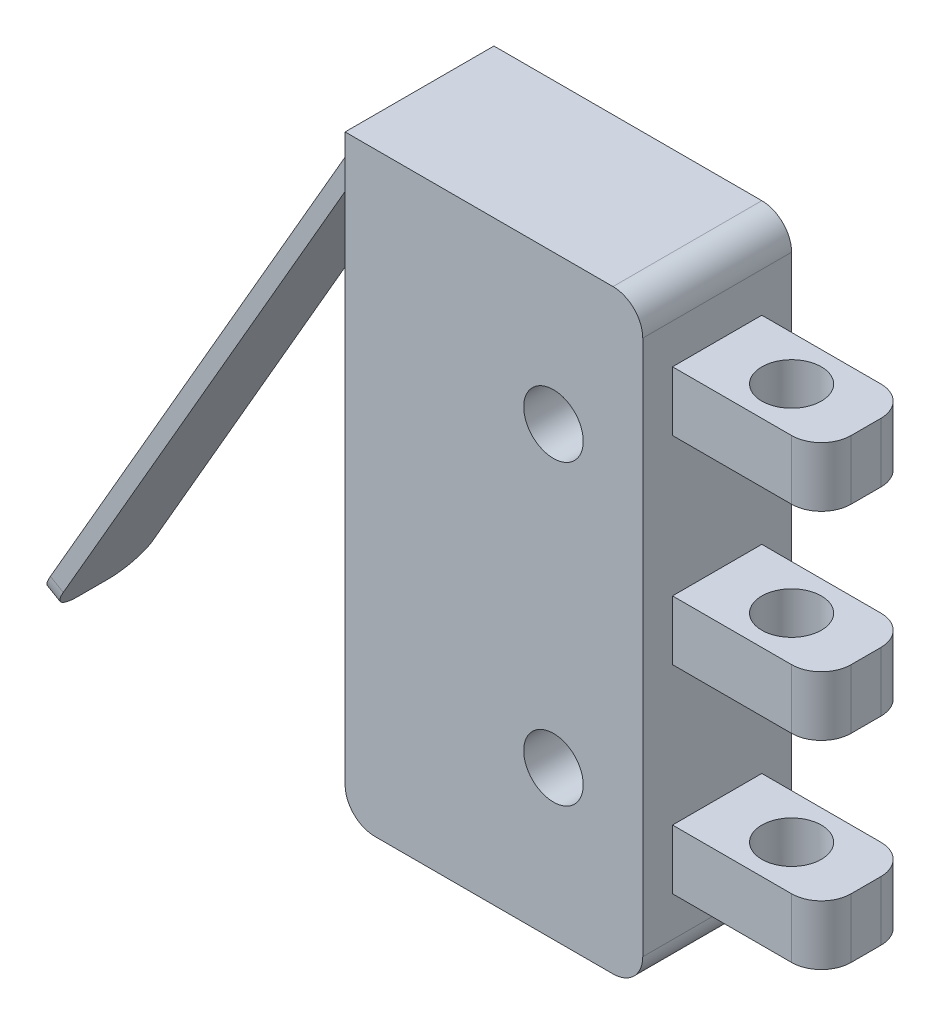
from build123d import *

# Parameters (mm, degrees)
ESQUISSE1_W             = 10
ESQUISSE1_H             = 20
ESQUISSE1_R             = 1
BOSS_EXTRU_1_DEPTH      = 2.5
ESQUISSE1_3_W           = 5
ESQUISSE1_3_H           = 2
BOSS_EXTRU_2_DEPTH      = 1.5
BOSS_EXTRU_3_DEPTH      = 1.5
ENL_V_MAT_EXTRU_1_REACH = 26.237
ESQUISSE3_R             = 1
CONG_1_R                = 1
CONG_2_R                = 1


# Read off the part's stored shape, not the designer's step: Révolution1
with BuildPart() as part:
    # Esquisse1 → Boss.-Extru.1 (new, symmetric)
    with BuildSketch(Plane.XY):
        Rectangle(ESQUISSE1_W, ESQUISSE1_H)
        with Locations((2, -5)):
            Circle(ESQUISSE1_R, mode=Mode.SUBTRACT)
        with Locations((2, 5)):
            Circle(ESQUISSE1_R, mode=Mode.SUBTRACT)
    extrude(amount=BOSS_EXTRU_1_DEPTH, both=True)

    # Esquisse1<3> → Boss.-Extru.2 (add, symmetric)
    with BuildSketch(Plane.XY):
        with Locations((7.5, 6.666666667)):
            Rectangle(ESQUISSE1_3_W, ESQUISSE1_3_H)
        with Locations((7.5, 0)):
            Rectangle(ESQUISSE1_3_W, ESQUISSE1_3_H)
        with Locations((7.5, -6.666666667)):
            Rectangle(ESQUISSE1_3_W, ESQUISSE1_3_H)
    extrude(amount=BOSS_EXTRU_2_DEPTH, both=True)

    # Esquisse1<5> → Boss.-Extru.3 (add, symmetric)
    with BuildSketch(Plane.XY):
        Polygon((-5, 9), (-5, 10), (-16.402667816, -9.75), (-15.969655115, -10), align=None)
    extrude(amount=BOSS_EXTRU_3_DEPTH, both=True)

    # Révolution1 outline → Révolution1 (revolve)
    with BuildSketch(Plane(origin=(-8.080127019, 4.665063509, 0), x_dir=(0.8660254037844386, -0.4999999999999999, 0), z_dir=(0, 0, 1))):
        with BuildLine():
            Line((0.5, -14.145081595), (0.5, 3.660254038))
            ThreePointArc((0.5, 3.660254038), (0.35355339, 4.013807428), (0, 4.160254038))
            Line((0, 4.160254038), (0, -14.645081595))
            ThreePointArc((0, -14.645081595), (0.353553391, -14.498634986), (0.5, -14.145081595))
        make_face()
    revolve(axis=Axis((-8.080127019, 4.665063509, 0), (0.4999999999999999, 0.8660254037844386, 0)))

    # Enlèv. mat.-Extru.1: up to this face of the body (flat: up to its plane)
    enl_v_mat_extru_1_end = Plane(part.part.faces().sort_by_distance((7.5, -7.666666667, 0))[0])
    # Esquisse3 → Enlèv. mat.-Extru.1 (cut, up to the picked face)
    with BuildSketch(Plane(origin=(0, 7.666666667, 0), x_dir=(1, 0, 0), z_dir=(0, 1, 0)), mode=Mode.PRIVATE) as enl_v_mat_extru_1_sk1:
        with Locations(Location((7.5, 0, 0), (0, 0, 270))):
            Circle(ESQUISSE3_R)
    enl_v_mat_extru_1_tool1 = split(extrude(enl_v_mat_extru_1_sk1.sketch, amount=-ENL_V_MAT_EXTRU_1_REACH, mode=Mode.PRIVATE), bisect_by=enl_v_mat_extru_1_end, keep=Keep.BOTH, mode=Mode.PRIVATE)
    add(enl_v_mat_extru_1_tool1.solids().sort_by(Axis((7.5, 7.666667, 0), (0, -1, 0)))[0], mode=Mode.SUBTRACT)

    # Congé1
    cong_1_edges = [part.edges().sort_by_distance(p)[0] for p in [
        (5, -10, 0),
        (-5, -10, 0),
        (5, 10, 0),
        (-16.186161466, -9.875, -1.5),
        (-16.186161466, -9.875, 1.5),
    ]]
    fillet(cong_1_edges, radius=CONG_1_R)

    # Congé2
    cong_2_edges = [part.edges().sort_by_distance(p)[0] for p in [
        (10, 6.666666667, 1.5),
        (10, 6.666666667, -1.5),
        (10, 0, 1.5),
        (10, 0, -1.5),
        (10, -6.666666667, -1.5),
        (10, -6.666666667, 1.5),
    ]]
    fillet(cong_2_edges, radius=CONG_2_R)


solid = part.part
